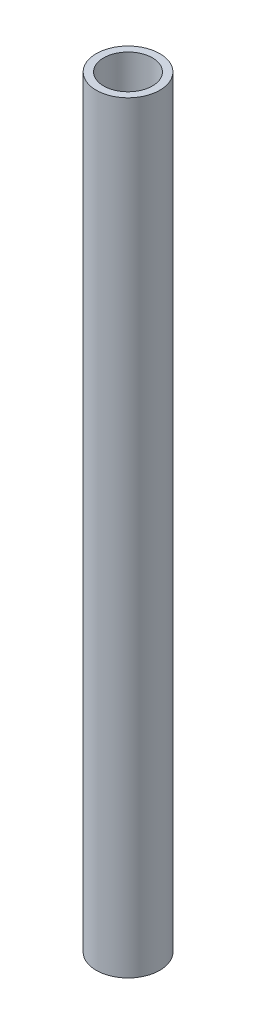
from build123d import *

# Parameters (mm, degrees)
SKETCH1_R           = 6.35
SKETCH1_R_2         = 4.8768
BOSS_EXTRUDE1_DEPTH = 152.4


with BuildPart() as part:
    # Sketch1 → Boss-Extrude1 (new body)
    with BuildSketch(Plane(origin=(0, 0, 0), x_dir=(1, 0, 0), z_dir=(0, 1, 0))):
        Circle(SKETCH1_R)
        Circle(SKETCH1_R_2, mode=Mode.SUBTRACT)
    extrude(amount=BOSS_EXTRUDE1_DEPTH)


solid = part.part
